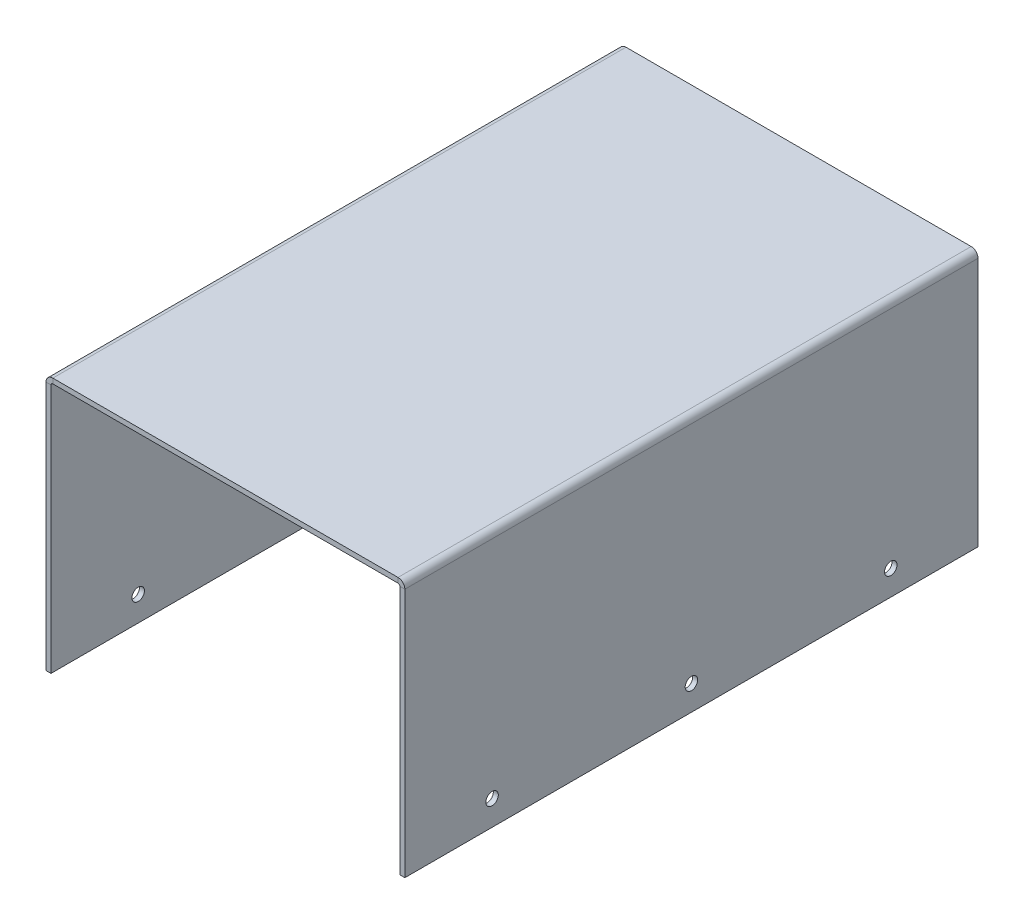
from build123d import *

# Parameters (mm, degrees)
SKETCH2_W                    = 140
SKETCH2_H                    = 230
BASE_FLANGE1_DEPTH           = 2
EDGE_FLANGE1_STRIP_W         = 9.4732
EDGE_FLANGE1_STRIP_H         = 2
EDGE_FLANGE1_STRIP_CUT_DEPTH = 230
EDGE_FLANGE1_DEPTH           = 230
F_5_0_5_DIAMETER_HOLE1_D     = 5
F_5_0_5_DIAMETER_HOLE1_DEPTH = 144


# Sheet-metal steps are written as plain solids
with BuildPart() as part:
    # Sketch2 → Base-Flange1 (new body)
    with BuildSketch(Plane(origin=(0, 0, 0), x_dir=(1, 0, 0), z_dir=(0, 1, 0))):
        Rectangle(SKETCH2_W, SKETCH2_H)
    extrude(amount=BASE_FLANGE1_DEPTH)

    # Edge-Flange1 strip (across the edge) → Edge-Flange1 strip cut (cut)
    with BuildSketch(Plane(origin=(70, 0, -115), x_dir=(-1, 0, 0), z_dir=(0, 0, 1))):
        with Locations((-4, -1)):
            Rectangle(EDGE_FLANGE1_STRIP_W, EDGE_FLANGE1_STRIP_H)
    edge_flange1_strip_cut = extrude(amount=EDGE_FLANGE1_STRIP_CUT_DEPTH, mode=Mode.SUBTRACT)

    # Edge-Flange1 section (across the edge) → Edge-Flange1 (add)
    with BuildSketch(Plane(origin=(70, 0, -115), x_dir=(-1, 0, 0), z_dir=(0, 0, 1))):
        with BuildLine():
            Line((-2, 0.7366), (-2, 101))
            Line((-2, 101), (0, 101))
            Line((0, 101), (0, 0.7366))
            ThreePointArc((0, 0.7366), (0.215745145, 0.215745145), (0.7366, 0))
            Line((0.7366, 0), (0.7366, -2))
            ThreePointArc((0.7366, -2), (-1.198468417, -1.198468417), (-2, 0.7366))
        make_face()
    edge_flange1 = extrude(amount=EDGE_FLANGE1_DEPTH)

    # Ø5.0 (5) Diameter Hole1
    with Locations(Plane(origin=(72, 0, 0), x_dir=(0, 0, -1), z_dir=(1, 0, 0))):
        with Locations((0, -91), (80, -91), (-80, -91)):
            f_5_0_5_diameter_hole1 = Hole(F_5_0_5_DIAMETER_HOLE1_D / 2, depth=F_5_0_5_DIAMETER_HOLE1_DEPTH)

    # Mirror1: Edge-Flange1 strip cut, Edge-Flange1, Ø5.0 (5) Diameter Hole1 across plane
    add(edge_flange1_strip_cut.mirror(Plane(origin=(0, 0, 0), x_dir=(0, 0, 1), z_dir=(1, 0, 0))), mode=Mode.SUBTRACT)
    add(edge_flange1.mirror(Plane(origin=(0, 0, 0), x_dir=(0, 0, 1), z_dir=(1, 0, 0))))
    add(f_5_0_5_diameter_hole1.mirror(Plane(origin=(0, 0, 0), x_dir=(0, 0, 1), z_dir=(1, 0, 0))), mode=Mode.SUBTRACT)


solid = part.part
